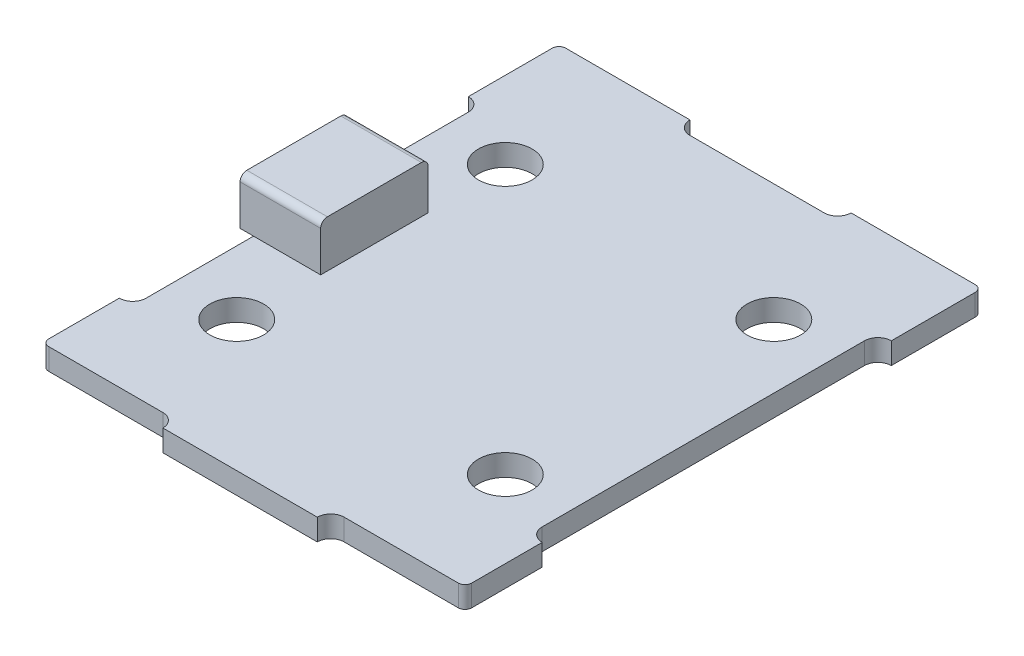
from build123d import *

# Parameters (mm, degrees)
SKETCH1_R           = 2
BOSS_EXTRUDE1_DEPTH = 1.6
SKETCH2_W           = 6
SKETCH2_H           = 8
BOSS_EXTRUDE2_DEPTH = 3.5
FILLET1_R           = 1
FILLET2_R           = 0.5
SKETCH3_W           = 7
SKETCH3_H           = 2.5
CUT_EXTRUDE1_DEPTH  = 5


with BuildPart() as part:
    # Sketch1 → Boss-Extrude1 (new body)
    with BuildSketch(Plane(origin=(0, 0, 0), x_dir=(1, 0, 0), z_dir=(0, 1, 0))):
        Polygon((15.75, 13), (15.75, 19.75), (6, 19.75), (6, 18.75), (-6, 18.75), (-6, 19.75), (-15.75, 19.75), (-15.75, 13), (-14.75, 13), (-14.75, -13), (-15.75, -13), (-15.75, -18.75), (-5.75, -18.75), (-5.75, -19.75), (5.75, -19.75), (5.75, -18.75), (15.75, -18.75), (15.75, -13), (14.75, -13), (14.75, 13), align=None)
        with Locations(Location((10, -10, 0), (0, 0, 270))):
            Circle(SKETCH1_R, mode=Mode.SUBTRACT)
        with Locations(Location((10, 10, 0), (0, 0, 270))):
            Circle(SKETCH1_R, mode=Mode.SUBTRACT)
        with Locations(Location((-10, 10, 0), (0, 0, 270))):
            Circle(SKETCH1_R, mode=Mode.SUBTRACT)
        with Locations(Location((-10, -10, 0), (0, 0, 270))):
            Circle(SKETCH1_R, mode=Mode.SUBTRACT)
    extrude(amount=BOSS_EXTRUDE1_DEPTH)

    # Sketch2 → Boss-Extrude2 (add)
    with BuildSketch(Plane(origin=(0, 1.6, 0), x_dir=(1, 0, 0), z_dir=(0, 1, 0))):
        with Locations((-12.75, 0)):
            Rectangle(SKETCH2_W, SKETCH2_H)
    extrude(amount=BOSS_EXTRUDE2_DEPTH)

    # Fillet1
    fillet1_edges = [part.edges().sort_by_distance(p)[0] for p in [
        (14.75, 0.8, -13),
        (14.75, 0.8, 13),
        (-6, 0.8, -18.75),
        (6, 0.8, -18.75),
        (-14.75, 0.8, -13),
        (-14.75, 0.8, 13),
        (-5.75, 0.8, 18.75),
        (5.75, 0.8, 18.75),
    ]]
    fillet(fillet1_edges, radius=FILLET1_R - 0.0001)  # a hair under: the kernel refuses the full size

    # Fillet2
    fillet2_edges = [part.edges().sort_by_distance(p)[0] for p in [
        (-15.75, 0.8, 18.75),
        (-15.75, 0.8, -19.75),
        (15.75, 0.8, -19.75),
        (15.75, 0.8, 18.75),
        (-12.75, 5.1, -4),
        (-12.75, 5.1, 4),
    ]]
    fillet(fillet2_edges, radius=FILLET2_R)

    # Sketch3 → Cut-Extrude1 (cut)
    with BuildSketch(Plane.ZY.offset(15.75)):
        with Locations((0, 3.35)):
            Rectangle(SKETCH3_W, SKETCH3_H)
    extrude(amount=-CUT_EXTRUDE1_DEPTH, mode=Mode.SUBTRACT)


solid = part.part
